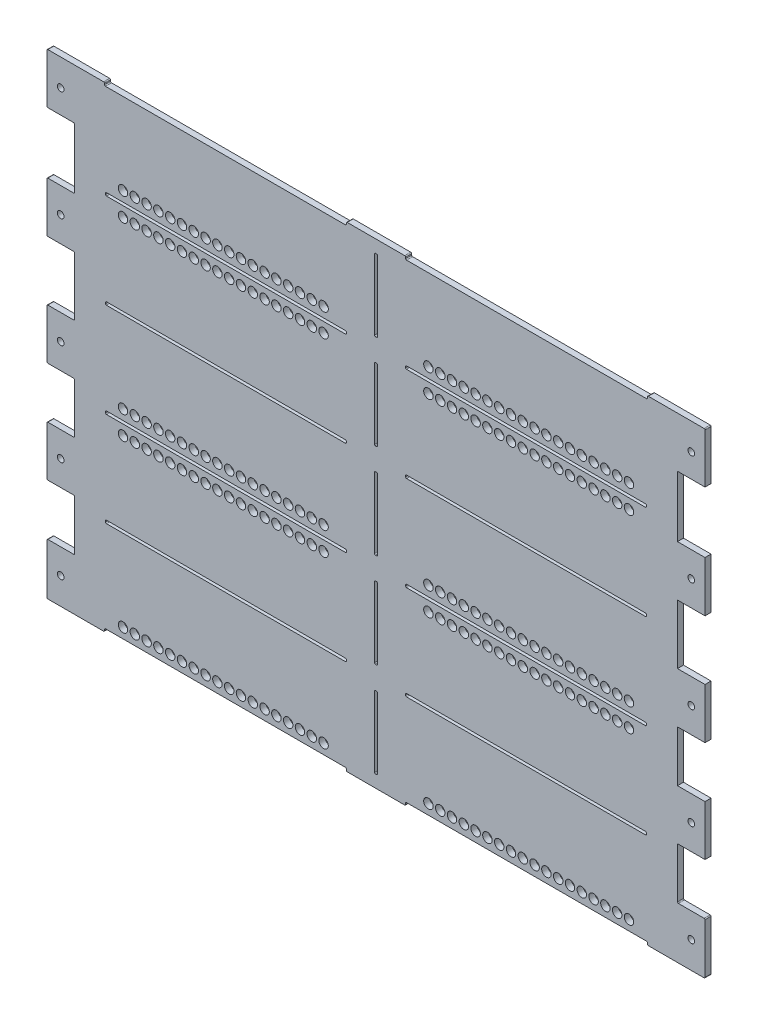
from build123d import *

# Parameters (mm, degrees)
SKETCH2_W            = 629.90984
SKETCH2_H            = 495.5921
SKETCH2_W_2          = 254
SKETCH2_H_2          = 3.175
SKETCH2_W_3          = 3.175
SKETCH2_H_3          = 76.2
BOSS_EXTRUDE1_DEPTH  = 6.35
SKETCH4_W            = 62.54242
SKETCH4_H            = 3.175
SKETCH4_W_2          = 28.585012188
BOSS_EXTRUDE2_DEPTH  = 6.35
BOSS_EXTRUDE3_DEPTH  = 6.35
M6_CLEARANCE_HOLE1_D = 7
SKETCH13_W           = 29.04896256
SKETCH13_H           = 64.32970153
SKETCH13_H_2         = 62.654099828
SKETCH13_H_3         = 53.800492857
SKETCH13_H_4         = 54.114683954
CUT_EXTRUDE1_DEPTH   = 828.140731679
SKETCH15_R           = 5
CUT_EXTRUDE5_DEPTH   = 828.140731679
FILLET1_R            = 1
FILLET2_R            = 1


with BuildPart() as part:
    # Sketch2 → Boss-Extrude1 (new body)
    with BuildSketch(Plane.XY):
        with Locations((313.68492, 246.52605)):
            Rectangle(SKETCH2_W, SKETCH2_H)
        with Locations((155.41371, 96.89592)):
            Rectangle(SKETCH2_W_2, SKETCH2_H_2, mode=Mode.SUBTRACT)
        with Locations((155.41371, 196.64934)):
            Rectangle(SKETCH2_W_2, SKETCH2_H_2, mode=Mode.SUBTRACT)
        with Locations((155.41371, 296.40276)):
            Rectangle(SKETCH2_W_2, SKETCH2_H_2, mode=Mode.SUBTRACT)
        with Locations((155.41371, 396.15618)):
            Rectangle(SKETCH2_W_2, SKETCH2_H_2, mode=Mode.SUBTRACT)
        with Locations((471.95613, 96.89592)):
            Rectangle(SKETCH2_W_2, SKETCH2_H_2, mode=Mode.SUBTRACT)
        with Locations((471.95613, 196.64934)):
            Rectangle(SKETCH2_W_2, SKETCH2_H_2, mode=Mode.SUBTRACT)
        with Locations((471.95613, 396.15618)):
            Rectangle(SKETCH2_W_2, SKETCH2_H_2, mode=Mode.SUBTRACT)
        with Locations((471.95613, 296.40276)):
            Rectangle(SKETCH2_W_2, SKETCH2_H_2, mode=Mode.SUBTRACT)
        with Locations((313.68492, 46.625498166)):
            Rectangle(SKETCH2_W_3, SKETCH2_H_3, mode=Mode.SUBTRACT)
        with Locations((313.68492, 146.77263)):
            Rectangle(SKETCH2_W_3, SKETCH2_H_3, mode=Mode.SUBTRACT)
        with Locations((313.68492, 246.52605)):
            Rectangle(SKETCH2_W_3, SKETCH2_H_3, mode=Mode.SUBTRACT)
        with Locations((313.68492, 346.27947)):
            Rectangle(SKETCH2_W_3, SKETCH2_H_3, mode=Mode.SUBTRACT)
        with Locations((313.68492, 446.03289)):
            Rectangle(SKETCH2_W_3, SKETCH2_H_3, mode=Mode.SUBTRACT)
    extrude(amount=BOSS_EXTRUDE1_DEPTH)

    # Sketch4 → Boss-Extrude2 (add, through all)
    with BuildSketch(Plane.XY.offset(6.35)):
        with Locations((313.68492, 495.9096)):
            Rectangle(SKETCH4_W, SKETCH4_H)
        with Locations((13.022506094, -2.8575)):
            Rectangle(SKETCH4_W_2, SKETCH4_H)
        with Locations((614.347333906, -2.8575)):
            Rectangle(SKETCH4_W_2, SKETCH4_H)
        with Locations((313.68492, -2.8575)):
            Rectangle(SKETCH4_W, SKETCH4_H)
        with Locations((614.347333906, 495.9096)):
            Rectangle(SKETCH4_W_2, SKETCH4_H)
        with Locations((13.022506094, 495.9096)):
            Rectangle(SKETCH4_W_2, SKETCH4_H)
    extrude(amount=-BOSS_EXTRUDE2_DEPTH)

    # Sketch5 → Boss-Extrude3 (add, through all)
    with BuildSketch(Plane.XY.offset(6.35)):
        Polygon((-33.401, 494.3221), (-33.401, 497.4971), (-1.27, 497.4971), (-1.27, 494.3221), (-1.27, -4.445), (-33.401, -4.445), align=None)
        Polygon((628.63984, 494.3221), (628.63984, -4.445), (660.77084, -4.445), (660.77084, 494.3221), (660.77084, 497.4971), (628.63984, 497.4971), align=None)
    extrude(amount=-BOSS_EXTRUDE3_DEPTH)

    # M6 Clearance Hole1 (through all)
    with Locations(Plane.XY.offset(6.35)):
        with Locations((-18.923, 469.322099962), (-18.923, 353.404472554), (-18.923, 237.486845146), (-18.923, 130.608422592), (-18.923, 23.730000038), (646.29284, 23.730000038), (646.29284, 130.608422592), (646.29284, 237.486845146), (646.29284, 353.404472554), (646.29284, 469.322099962)):
            Hole(M6_CLEARANCE_HOLE1_D / 2)

    # Sketch13 → Cut-Extrude1 (cut, through all)
    with BuildSketch(Plane.XY.offset(6.35)):
        with Locations((-18.87651872, 412.232249235)):
            Rectangle(SKETCH13_W, SKETCH13_H)
        with Locations((-18.87651872, 295.414496724)):
            Rectangle(SKETCH13_W, SKETCH13_H_2)
        with Locations((-18.87651872, 183.985997055)):
            Rectangle(SKETCH13_W, SKETCH13_H_3)
        with Locations((-18.87651872, 77.073752581)):
            Rectangle(SKETCH13_W, SKETCH13_H_4)
        with Locations((646.24635872, 77.073752581)):
            Rectangle(SKETCH13_W, SKETCH13_H_4)
        with Locations((646.24635872, 183.985997055)):
            Rectangle(SKETCH13_W, SKETCH13_H_3)
        with Locations((646.24635872, 295.414496724)):
            Rectangle(SKETCH13_W, SKETCH13_H_2)
        with Locations((646.24635872, 412.232249235)):
            Rectangle(SKETCH13_W, SKETCH13_H)
    extrude(amount=-CUT_EXTRUDE1_DEPTH, mode=Mode.SUBTRACT)

    # Sketch15 → Cut-Extrude5 (cut, through all)
    with BuildSketch(Plane.XY):
        with Locations((46.80458, 408.41168)):
            Circle(SKETCH15_R)
        with Locations((46.80458, 383.90068)):
            Circle(SKETCH15_R)
        with Locations((46.80458, 208.90484)):
            Circle(SKETCH15_R)
        with Locations((46.80458, 184.39384)):
            Circle(SKETCH15_R)
        with Locations((46.80458, 9.398)):
            Circle(SKETCH15_R)
        with Locations((59.25058, 408.41168)):
            Circle(SKETCH15_R)
        with Locations((59.25058, 383.90068)):
            Circle(SKETCH15_R)
        with Locations((59.25058, 208.90484)):
            Circle(SKETCH15_R)
        with Locations((59.25058, 184.39384)):
            Circle(SKETCH15_R)
        with Locations((59.25058, 9.398)):
            Circle(SKETCH15_R)
        with Locations((71.69658, 408.41168)):
            Circle(SKETCH15_R)
        with Locations((71.69658, 383.90068)):
            Circle(SKETCH15_R)
        with Locations((71.69658, 208.90484)):
            Circle(SKETCH15_R)
        with Locations((71.69658, 184.39384)):
            Circle(SKETCH15_R)
        with Locations((71.69658, 9.398)):
            Circle(SKETCH15_R)
        with Locations((84.14258, 408.41168)):
            Circle(SKETCH15_R)
        with Locations((84.14258, 383.90068)):
            Circle(SKETCH15_R)
        with Locations((84.14258, 208.90484)):
            Circle(SKETCH15_R)
        with Locations((84.14258, 184.39384)):
            Circle(SKETCH15_R)
        with Locations((84.14258, 9.398)):
            Circle(SKETCH15_R)
        with Locations((96.58858, 408.41168)):
            Circle(SKETCH15_R)
        with Locations((96.58858, 383.90068)):
            Circle(SKETCH15_R)
        with Locations((96.58858, 208.90484)):
            Circle(SKETCH15_R)
        with Locations((96.58858, 184.39384)):
            Circle(SKETCH15_R)
        with Locations((96.58858, 9.398)):
            Circle(SKETCH15_R)
        with Locations((109.03458, 408.41168)):
            Circle(SKETCH15_R)
        with Locations((109.03458, 383.90068)):
            Circle(SKETCH15_R)
        with Locations((109.03458, 208.90484)):
            Circle(SKETCH15_R)
        with Locations((109.03458, 184.39384)):
            Circle(SKETCH15_R)
        with Locations((109.03458, 9.398)):
            Circle(SKETCH15_R)
        with Locations((121.48058, 408.41168)):
            Circle(SKETCH15_R)
        with Locations((121.48058, 383.90068)):
            Circle(SKETCH15_R)
        with Locations((121.48058, 208.90484)):
            Circle(SKETCH15_R)
        with Locations((121.48058, 184.39384)):
            Circle(SKETCH15_R)
        with Locations((121.48058, 9.398)):
            Circle(SKETCH15_R)
        with Locations((133.92658, 408.41168)):
            Circle(SKETCH15_R)
        with Locations((133.92658, 383.90068)):
            Circle(SKETCH15_R)
        with Locations((133.92658, 208.90484)):
            Circle(SKETCH15_R)
        with Locations((133.92658, 184.39384)):
            Circle(SKETCH15_R)
        with Locations((133.92658, 9.398)):
            Circle(SKETCH15_R)
        with Locations((146.37258, 408.41168)):
            Circle(SKETCH15_R)
        with Locations((146.37258, 383.90068)):
            Circle(SKETCH15_R)
        with Locations((146.37258, 208.90484)):
            Circle(SKETCH15_R)
        with Locations((146.37258, 184.39384)):
            Circle(SKETCH15_R)
        with Locations((146.37258, 9.398)):
            Circle(SKETCH15_R)
        with Locations((158.81858, 408.41168)):
            Circle(SKETCH15_R)
        with Locations((158.81858, 383.90068)):
            Circle(SKETCH15_R)
        with Locations((158.81858, 208.90484)):
            Circle(SKETCH15_R)
        with Locations((158.81858, 184.39384)):
            Circle(SKETCH15_R)
        with Locations((158.81858, 9.398)):
            Circle(SKETCH15_R)
        with Locations((171.26458, 408.41168)):
            Circle(SKETCH15_R)
        with Locations((171.26458, 383.90068)):
            Circle(SKETCH15_R)
        with Locations((171.26458, 208.90484)):
            Circle(SKETCH15_R)
        with Locations((171.26458, 184.39384)):
            Circle(SKETCH15_R)
        with Locations((171.26458, 9.398)):
            Circle(SKETCH15_R)
        with Locations((183.71058, 408.41168)):
            Circle(SKETCH15_R)
        with Locations((183.71058, 383.90068)):
            Circle(SKETCH15_R)
        with Locations((183.71058, 208.90484)):
            Circle(SKETCH15_R)
        with Locations((183.71058, 184.39384)):
            Circle(SKETCH15_R)
        with Locations((183.71058, 9.398)):
            Circle(SKETCH15_R)
        with Locations((196.15658, 408.41168)):
            Circle(SKETCH15_R)
        with Locations((196.15658, 383.90068)):
            Circle(SKETCH15_R)
        with Locations((196.15658, 208.90484)):
            Circle(SKETCH15_R)
        with Locations((196.15658, 184.39384)):
            Circle(SKETCH15_R)
        with Locations((196.15658, 9.398)):
            Circle(SKETCH15_R)
        with Locations((208.60258, 408.41168)):
            Circle(SKETCH15_R)
        with Locations((208.60258, 383.90068)):
            Circle(SKETCH15_R)
        with Locations((208.60258, 208.90484)):
            Circle(SKETCH15_R)
        with Locations((208.60258, 184.39384)):
            Circle(SKETCH15_R)
        with Locations((208.60258, 9.398)):
            Circle(SKETCH15_R)
        with Locations((221.04858, 408.41168)):
            Circle(SKETCH15_R)
        with Locations((221.04858, 383.90068)):
            Circle(SKETCH15_R)
        with Locations((221.04858, 208.90484)):
            Circle(SKETCH15_R)
        with Locations((221.04858, 184.39384)):
            Circle(SKETCH15_R)
        with Locations((221.04858, 9.398)):
            Circle(SKETCH15_R)
        with Locations((233.49458, 408.41168)):
            Circle(SKETCH15_R)
        with Locations((233.49458, 383.90068)):
            Circle(SKETCH15_R)
        with Locations((233.49458, 208.90484)):
            Circle(SKETCH15_R)
        with Locations((233.49458, 184.39384)):
            Circle(SKETCH15_R)
        with Locations((233.49458, 9.398)):
            Circle(SKETCH15_R)
        with Locations((245.94058, 408.41168)):
            Circle(SKETCH15_R)
        with Locations((245.94058, 383.90068)):
            Circle(SKETCH15_R)
        with Locations((245.94058, 208.90484)):
            Circle(SKETCH15_R)
        with Locations((245.94058, 184.39384)):
            Circle(SKETCH15_R)
        with Locations((245.94058, 9.398)):
            Circle(SKETCH15_R)
        with Locations((258.38658, 408.41168)):
            Circle(SKETCH15_R)
        with Locations((258.38658, 383.90068)):
            Circle(SKETCH15_R)
        with Locations((258.38658, 208.90484)):
            Circle(SKETCH15_R)
        with Locations((258.38658, 184.39384)):
            Circle(SKETCH15_R)
        with Locations((258.38658, 9.398)):
            Circle(SKETCH15_R)
        with Locations(Location((368.98326, 9.398, 0), (0, 0, 180))):
            Circle(SKETCH15_R)
        with Locations(Location((368.98326, 184.39384, 0), (0, 0, 180))):
            Circle(SKETCH15_R)
        with Locations(Location((368.98326, 208.90484, 0), (0, 0, 180))):
            Circle(SKETCH15_R)
        with Locations(Location((368.98326, 383.90068, 0), (0, 0, 180))):
            Circle(SKETCH15_R)
        with Locations(Location((368.98326, 408.41168, 0), (0, 0, 180))):
            Circle(SKETCH15_R)
        with Locations(Location((381.42926, 9.398, 0), (0, 0, 180))):
            Circle(SKETCH15_R)
        with Locations(Location((381.42926, 184.39384, 0), (0, 0, 180))):
            Circle(SKETCH15_R)
        with Locations(Location((381.42926, 208.90484, 0), (0, 0, 180))):
            Circle(SKETCH15_R)
        with Locations(Location((381.42926, 383.90068, 0), (0, 0, 180))):
            Circle(SKETCH15_R)
        with Locations(Location((381.42926, 408.41168, 0), (0, 0, 180))):
            Circle(SKETCH15_R)
        with Locations(Location((393.87526, 9.398, 0), (0, 0, 180))):
            Circle(SKETCH15_R)
        with Locations(Location((393.87526, 184.39384, 0), (0, 0, 180))):
            Circle(SKETCH15_R)
        with Locations(Location((393.87526, 208.90484, 0), (0, 0, 180))):
            Circle(SKETCH15_R)
        with Locations(Location((393.87526, 383.90068, 0), (0, 0, 180))):
            Circle(SKETCH15_R)
        with Locations(Location((393.87526, 408.41168, 0), (0, 0, 180))):
            Circle(SKETCH15_R)
        with Locations(Location((406.32126, 9.398, 0), (0, 0, 180))):
            Circle(SKETCH15_R)
        with Locations(Location((406.32126, 184.39384, 0), (0, 0, 180))):
            Circle(SKETCH15_R)
        with Locations(Location((406.32126, 208.90484, 0), (0, 0, 180))):
            Circle(SKETCH15_R)
        with Locations(Location((406.32126, 383.90068, 0), (0, 0, 180))):
            Circle(SKETCH15_R)
        with Locations(Location((406.32126, 408.41168, 0), (0, 0, 180))):
            Circle(SKETCH15_R)
        with Locations(Location((418.76726, 9.398, 0), (0, 0, 180))):
            Circle(SKETCH15_R)
        with Locations(Location((418.76726, 184.39384, 0), (0, 0, 180))):
            Circle(SKETCH15_R)
        with Locations(Location((418.76726, 208.90484, 0), (0, 0, 180))):
            Circle(SKETCH15_R)
        with Locations(Location((418.76726, 383.90068, 0), (0, 0, 180))):
            Circle(SKETCH15_R)
        with Locations(Location((418.76726, 408.41168, 0), (0, 0, 180))):
            Circle(SKETCH15_R)
        with Locations(Location((431.21326, 9.398, 0), (0, 0, 180))):
            Circle(SKETCH15_R)
        with Locations(Location((431.21326, 184.39384, 0), (0, 0, 180))):
            Circle(SKETCH15_R)
        with Locations(Location((431.21326, 208.90484, 0), (0, 0, 180))):
            Circle(SKETCH15_R)
        with Locations(Location((431.21326, 383.90068, 0), (0, 0, 180))):
            Circle(SKETCH15_R)
        with Locations(Location((431.21326, 408.41168, 0), (0, 0, 180))):
            Circle(SKETCH15_R)
        with Locations(Location((443.65926, 9.398, 0), (0, 0, 180))):
            Circle(SKETCH15_R)
        with Locations(Location((443.65926, 184.39384, 0), (0, 0, 180))):
            Circle(SKETCH15_R)
        with Locations(Location((443.65926, 208.90484, 0), (0, 0, 180))):
            Circle(SKETCH15_R)
        with Locations(Location((443.65926, 383.90068, 0), (0, 0, 180))):
            Circle(SKETCH15_R)
        with Locations(Location((443.65926, 408.41168, 0), (0, 0, 180))):
            Circle(SKETCH15_R)
        with Locations(Location((456.10526, 9.398, 0), (0, 0, 180))):
            Circle(SKETCH15_R)
        with Locations(Location((456.10526, 184.39384, 0), (0, 0, 180))):
            Circle(SKETCH15_R)
        with Locations(Location((456.10526, 208.90484, 0), (0, 0, 180))):
            Circle(SKETCH15_R)
        with Locations(Location((456.10526, 383.90068, 0), (0, 0, 180))):
            Circle(SKETCH15_R)
        with Locations(Location((456.10526, 408.41168, 0), (0, 0, 180))):
            Circle(SKETCH15_R)
        with Locations(Location((468.55126, 9.398, 0), (0, 0, 180))):
            Circle(SKETCH15_R)
        with Locations(Location((468.55126, 184.39384, 0), (0, 0, 180))):
            Circle(SKETCH15_R)
        with Locations(Location((468.55126, 208.90484, 0), (0, 0, 180))):
            Circle(SKETCH15_R)
        with Locations(Location((468.55126, 383.90068, 0), (0, 0, 180))):
            Circle(SKETCH15_R)
        with Locations(Location((468.55126, 408.41168, 0), (0, 0, 180))):
            Circle(SKETCH15_R)
        with Locations(Location((480.99726, 9.398, 0), (0, 0, 180))):
            Circle(SKETCH15_R)
        with Locations(Location((480.99726, 184.39384, 0), (0, 0, 180))):
            Circle(SKETCH15_R)
        with Locations(Location((480.99726, 208.90484, 0), (0, 0, 180))):
            Circle(SKETCH15_R)
        with Locations(Location((480.99726, 383.90068, 0), (0, 0, 180))):
            Circle(SKETCH15_R)
        with Locations(Location((480.99726, 408.41168, 0), (0, 0, 180))):
            Circle(SKETCH15_R)
        with Locations(Location((493.44326, 9.398, 0), (0, 0, 180))):
            Circle(SKETCH15_R)
        with Locations(Location((493.44326, 184.39384, 0), (0, 0, 180))):
            Circle(SKETCH15_R)
        with Locations(Location((493.44326, 208.90484, 0), (0, 0, 180))):
            Circle(SKETCH15_R)
        with Locations(Location((493.44326, 383.90068, 0), (0, 0, 180))):
            Circle(SKETCH15_R)
        with Locations(Location((493.44326, 408.41168, 0), (0, 0, 180))):
            Circle(SKETCH15_R)
        with Locations(Location((505.88926, 9.398, 0), (0, 0, 180))):
            Circle(SKETCH15_R)
        with Locations(Location((505.88926, 184.39384, 0), (0, 0, 180))):
            Circle(SKETCH15_R)
        with Locations(Location((505.88926, 208.90484, 0), (0, 0, 180))):
            Circle(SKETCH15_R)
        with Locations(Location((505.88926, 383.90068, 0), (0, 0, 180))):
            Circle(SKETCH15_R)
        with Locations(Location((505.88926, 408.41168, 0), (0, 0, 180))):
            Circle(SKETCH15_R)
        with Locations(Location((518.33526, 9.398, 0), (0, 0, 180))):
            Circle(SKETCH15_R)
        with Locations(Location((518.33526, 184.39384, 0), (0, 0, 180))):
            Circle(SKETCH15_R)
        with Locations(Location((518.33526, 208.90484, 0), (0, 0, 180))):
            Circle(SKETCH15_R)
        with Locations(Location((518.33526, 383.90068, 0), (0, 0, 180))):
            Circle(SKETCH15_R)
        with Locations(Location((518.33526, 408.41168, 0), (0, 0, 180))):
            Circle(SKETCH15_R)
        with Locations(Location((530.78126, 9.398, 0), (0, 0, 180))):
            Circle(SKETCH15_R)
        with Locations(Location((530.78126, 184.39384, 0), (0, 0, 180))):
            Circle(SKETCH15_R)
        with Locations(Location((530.78126, 208.90484, 0), (0, 0, 180))):
            Circle(SKETCH15_R)
        with Locations(Location((530.78126, 383.90068, 0), (0, 0, 180))):
            Circle(SKETCH15_R)
        with Locations(Location((530.78126, 408.41168, 0), (0, 0, 180))):
            Circle(SKETCH15_R)
        with Locations(Location((543.22726, 9.398, 0), (0, 0, 180))):
            Circle(SKETCH15_R)
        with Locations(Location((543.22726, 184.39384, 0), (0, 0, 180))):
            Circle(SKETCH15_R)
        with Locations(Location((543.22726, 208.90484, 0), (0, 0, 180))):
            Circle(SKETCH15_R)
        with Locations(Location((543.22726, 383.90068, 0), (0, 0, 180))):
            Circle(SKETCH15_R)
        with Locations(Location((543.22726, 408.41168, 0), (0, 0, 180))):
            Circle(SKETCH15_R)
        with Locations(Location((555.67326, 9.398, 0), (0, 0, 180))):
            Circle(SKETCH15_R)
        with Locations(Location((555.67326, 184.39384, 0), (0, 0, 180))):
            Circle(SKETCH15_R)
        with Locations(Location((555.67326, 208.90484, 0), (0, 0, 180))):
            Circle(SKETCH15_R)
        with Locations(Location((555.67326, 383.90068, 0), (0, 0, 180))):
            Circle(SKETCH15_R)
        with Locations(Location((555.67326, 408.41168, 0), (0, 0, 180))):
            Circle(SKETCH15_R)
        with Locations(Location((568.11926, 9.398, 0), (0, 0, 180))):
            Circle(SKETCH15_R)
        with Locations(Location((568.11926, 184.39384, 0), (0, 0, 180))):
            Circle(SKETCH15_R)
        with Locations(Location((568.11926, 208.90484, 0), (0, 0, 180))):
            Circle(SKETCH15_R)
        with Locations(Location((568.11926, 383.90068, 0), (0, 0, 180))):
            Circle(SKETCH15_R)
        with Locations(Location((568.11926, 408.41168, 0), (0, 0, 180))):
            Circle(SKETCH15_R)
        with Locations(Location((580.56526, 9.398, 0), (0, 0, 180))):
            Circle(SKETCH15_R)
        with Locations(Location((580.56526, 184.39384, 0), (0, 0, 180))):
            Circle(SKETCH15_R)
        with Locations(Location((580.56526, 208.90484, 0), (0, 0, 180))):
            Circle(SKETCH15_R)
        with Locations(Location((580.56526, 383.90068, 0), (0, 0, 180))):
            Circle(SKETCH15_R)
        with Locations(Location((580.56526, 408.41168, 0), (0, 0, 180))):
            Circle(SKETCH15_R)
    extrude(amount=CUT_EXTRUDE5_DEPTH, mode=Mode.SUBTRACT)

    # Fillet1
    fillet1_edges = [part.edges().sort_by_distance(p)[0] for p in [
        (27.315012188, -1.27, 3.175),
        (27.315012188, -4.445, 3.175),
        (600.054827812, -1.27, 3.175),
        (600.054827812, -4.445, 3.175),
        (282.41371, 494.3221, 3.175),
        (282.41371, 497.4971, 3.175),
        (344.95613, 497.4971, 3.175),
        (344.95613, 494.3221, 3.175),
        (600.054827812, 494.3221, 3.175),
        (600.054827812, 497.4971, 3.175),
        (282.41371, -1.27, 3.175),
        (344.95613, -1.27, 3.175),
        (344.95613, -4.445, 3.175),
        (282.41371, -4.445, 3.175),
        (27.315012188, 497.4971, 3.175),
        (27.315012188, 494.3221, 3.175),
        (-33.401, 497.4971, 3.175),
        (-33.401, -4.445, 3.175),
        (660.77084, 497.4971, 3.175),
        (660.77084, -4.445, 3.175),
        (-33.401, 264.08744681, 3.175),
        (-33.401, 326.741546638, 3.175),
        (-4.35203744, 326.741546638, 3.175),
        (-4.35203744, 264.08744681, 3.175),
        (-4.35203744, 210.886243483, 3.175),
        (-4.35203744, 157.085750626, 3.175),
        (-33.401, 157.085750626, 3.175),
        (-33.401, 210.886243483, 3.175),
        (-33.401, 50.016410604, 3.175),
        (-33.401, 104.131094558, 3.175),
        (-4.35203744, 104.131094558, 3.175),
        (-4.35203744, 50.016410604, 3.175),
        (660.77084, 50.016410604, 3.175),
        (631.72187744, 50.016410604, 3.175),
        (-33.401, 380.06739847, 3.175),
        (-33.401, 444.3971, 3.175),
        (-4.35203744, 444.3971, 3.175),
        (-4.35203744, 380.06739847, 3.175),
    ]]
    fillet(fillet1_edges, radius=FILLET1_R)

    # Fillet2
    fillet2_edges = [part.edges().sort_by_distance(p)[0] for p in [
        (598.95613, 294.81526, 3.175),
        (598.95613, 297.99026, 3.175),
        (344.95613, 297.99026, 3.175),
        (344.95613, 294.81526, 3.175),
        (315.27242, 8.525498166, 3.175),
        (315.27242, 84.725498166, 3.175),
        (312.09742, 84.725498166, 3.175),
        (312.09742, 8.525498166, 3.175),
        (315.27242, 108.67263, 3.175),
        (315.27242, 184.87263, 3.175),
        (312.09742, 184.87263, 3.175),
        (312.09742, 108.67263, 3.175),
        (315.27242, 208.42605, 3.175),
        (315.27242, 284.62605, 3.175),
        (312.09742, 284.62605, 3.175),
        (312.09742, 208.42605, 3.175),
        (282.41371, 95.30842, 3.175),
        (315.27242, 308.17947, 3.175),
        (315.27242, 384.37947, 3.175),
        (312.09742, 384.37947, 3.175),
        (312.09742, 308.17947, 3.175),
        (282.41371, 98.48342, 3.175),
        (28.41371, 98.48342, 3.175),
        (28.41371, 95.30842, 3.175),
        (315.27242, 407.93289, 3.175),
        (315.27242, 484.13289, 3.175),
        (312.09742, 484.13289, 3.175),
        (312.09742, 407.93289, 3.175),
        (282.41371, 195.06184, 3.175),
        (282.41371, 198.23684, 3.175),
        (28.41371, 198.23684, 3.175),
        (28.41371, 195.06184, 3.175),
        (282.41371, 294.81526, 3.175),
        (282.41371, 297.99026, 3.175),
        (28.41371, 297.99026, 3.175),
        (28.41371, 294.81526, 3.175),
        (282.41371, 394.56868, 3.175),
        (282.41371, 397.74368, 3.175),
        (28.41371, 397.74368, 3.175),
        (28.41371, 394.56868, 3.175),
        (598.95613, 95.30842, 3.175),
        (598.95613, 98.48342, 3.175),
        (344.95613, 98.48342, 3.175),
        (344.95613, 95.30842, 3.175),
        (598.95613, 195.06184, 3.175),
        (598.95613, 198.23684, 3.175),
        (344.95613, 198.23684, 3.175),
        (344.95613, 195.06184, 3.175),
        (598.95613, 394.56868, 3.175),
        (598.95613, 397.74368, 3.175),
        (344.95613, 397.74368, 3.175),
        (344.95613, 394.56868, 3.175),
    ]]
    fillet(fillet2_edges, radius=FILLET2_R)


solid = part.part
